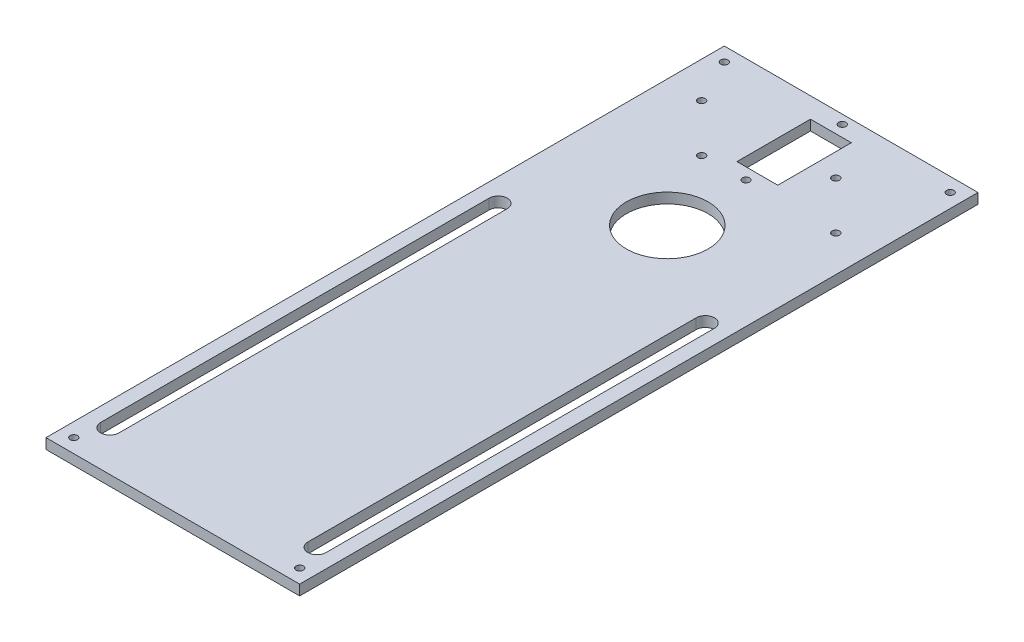
from build123d import *

# Parameters (mm, degrees)
SKETCH2_W           = 78.8444702
SKETCH2_H           = 3.2004
BOSS_EXTRUDE1_DEPTH = 210.82
SKETCH3_R           = 12.7
SKETCH3_R_2         = 1.1303
SKETCH3_R_3         = 1.143
SKETCH3_W           = 12.7
SKETCH3_H           = 22.86
CUT_EXTRUDE1_DEPTH  = 216.478809771


with BuildPart() as part:
    # Sketch2 → Boss-Extrude1 (new body)
    with BuildSketch(Plane.XY):
        with Locations((-5.0277649, -1.6002)):
            Rectangle(SKETCH2_W, SKETCH2_H)
    extrude(amount=BOSS_EXTRUDE1_DEPTH)

    # Sketch3 → Cut-Extrude1 (cut, through all)
    with BuildSketch(Plane.XZ.offset(3.2004)):
        with Locations((-5.0277649, 57.15)):
            Circle(SKETCH3_R)
        with Locations((-40.132, 206.502)):
            Circle(SKETCH3_R_2)
        with Locations((30.0764702, 206.502)):
            Circle(SKETCH3_R_2)
        with Locations((-40.132, 4.318)):
            Circle(SKETCH3_R_2)
        with Locations((30.0764702, 4.318)):
            Circle(SKETCH3_R_2)
        with Locations((-5.0277649, 32.686487591)):
            Circle(SKETCH3_R_2)
        with Locations((-5.0277649, 2.765287591)):
            Circle(SKETCH3_R_2)
        with Locations((23.2108502, 33.02)):
            Circle(SKETCH3_R_3)
        with Locations((8.424210122, 18.233359922)):
            Circle(SKETCH3_R_3)
        with Locations((-18.479739922, 33.02)):
            Circle(SKETCH3_R_3)
        with Locations((-33.26638, 18.233359922)):
            Circle(SKETCH3_R_3)
        with BuildLine():
            Line((-40.053517537, 77.517412284), (-40.053517537, 198.224041398))
            ThreePointArc((-40.053517537, 198.224041398), (-37.219693042, 201.057865893), (-34.385868547, 198.224041398))
            Line((-34.385868547, 198.224041398), (-34.385868547, 77.517412284))
            ThreePointArc((-34.385868547, 77.517412284), (-37.219693042, 74.683587789), (-40.053517537, 77.517412284))
        make_face()
        with BuildLine():
            Line((24.330338747, 77.517412284), (24.330338747, 198.224041398))
            ThreePointArc((24.330338747, 198.224041398), (27.164163242, 201.057865893), (29.997987737, 198.224041398))
            Line((29.997987737, 198.224041398), (29.997987737, 77.517412284))
            ThreePointArc((29.997987737, 77.517412284), (27.164163242, 74.683587789), (24.330338747, 77.517412284))
        make_face()
        with Locations((-5.0277649, 17.725887591)):
            Rectangle(SKETCH3_W, SKETCH3_H)
    extrude(amount=-CUT_EXTRUDE1_DEPTH, mode=Mode.SUBTRACT)


solid = part.part
